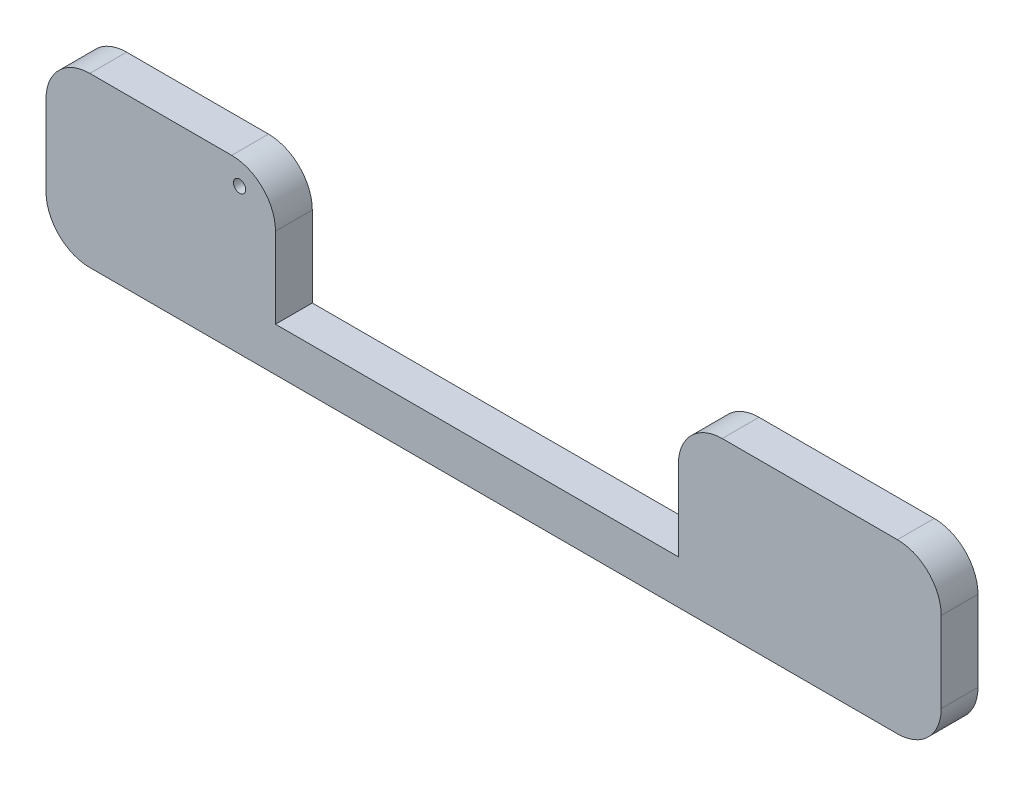
from build123d import *

# Parameters (mm, degrees)
SKETCH1_W           = 129.794
SKETCH1_H           = 24.384
BOSS_EXTRUDE1_DEPTH = 5.334
SKETCH3_W           = 58.42
SKETCH3_H           = 18.034
CUT_EXTRUDE1_DEPTH  = 104.917980915
FILLET1_R           = 6.35
SKETCH4_R           = 0.889
CUT_EXTRUDE2_DEPTH  = 104.917980915


with BuildPart() as part:
    # Sketch1 → Boss-Extrude1 (new body)
    with BuildSketch(Plane.XY):
        with Locations((-20.165445418, -47.262819662)):
            Rectangle(SKETCH1_W, SKETCH1_H)
    extrude(amount=BOSS_EXTRUDE1_DEPTH)

    # Sketch3 → Cut-Extrude1 (cut, through all)
    with BuildSketch(Plane.XY.offset(5.334)):
        with Locations((-22.578445418, -44.087819662)):
            Rectangle(SKETCH3_W, SKETCH3_H)
    extrude(amount=-CUT_EXTRUDE1_DEPTH, mode=Mode.SUBTRACT)

    # Fillet1
    fillet1_edges = [part.edges().sort_by_distance(p)[0] for p in [
        (-85.062445418, -35.070819662, 2.667),
        (-51.788445418, -35.070819662, 2.667),
        (6.631554582, -35.070819662, 2.667),
        (44.731554582, -35.070819662, 2.667),
        (44.731554582, -59.454819662, 2.667),
        (-85.062445418, -59.454819662, 2.667),
    ]]
    fillet(fillet1_edges, radius=FILLET1_R)

    # Sketch4 → Cut-Extrude2 (cut, through all)
    with BuildSketch(Plane.XY.offset(5.334)):
        with Locations((-56.995445418, -38.372819662)):
            Circle(SKETCH4_R)
    extrude(amount=-CUT_EXTRUDE2_DEPTH, mode=Mode.SUBTRACT)


solid = part.part
